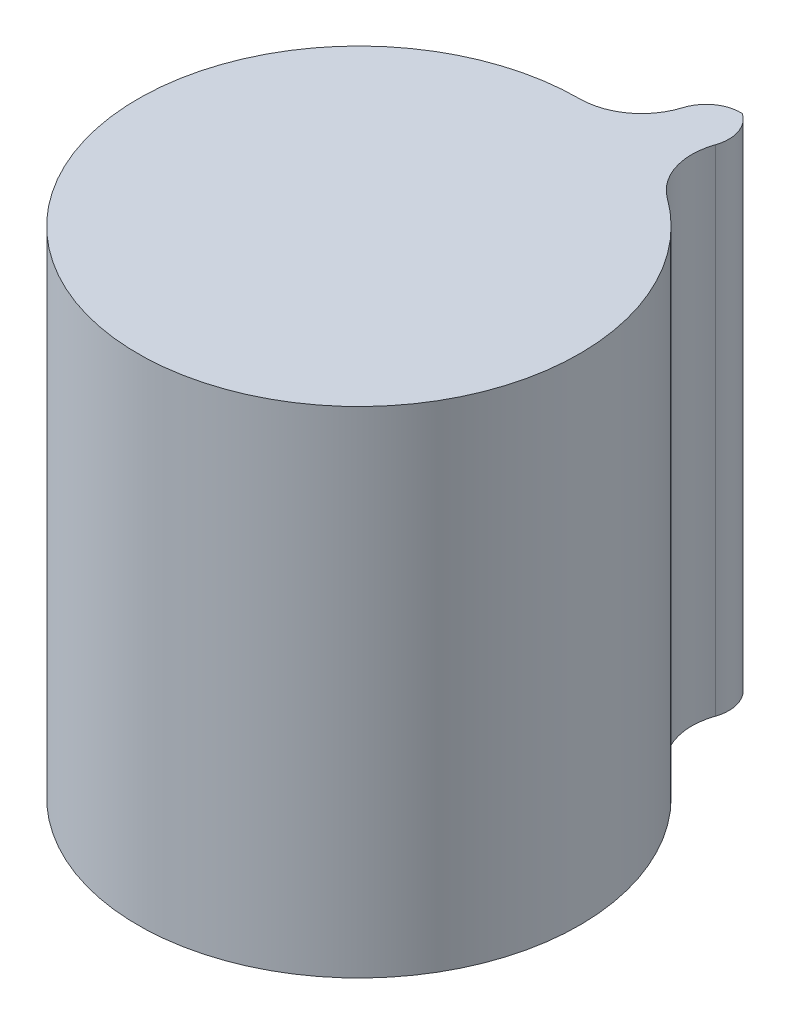
from build123d import *

# Parameters (mm, degrees)
BOSS_EXTRUDE1_DEPTH = 3.556


with BuildPart() as part:
    # Sketch1 → Boss-Extrude1 (new, symmetric)
    with BuildSketch(Plane(origin=(0, 0, 0), x_dir=(1, 0, 0), z_dir=(0, 1, 0))):
        with BuildLine():
            ThreePointArc((0.851535457, 3.803970871), (0.529976857, 3.34779037), (0, 3.172790042))
            ThreePointArc((0, 3.172790042), (-0.980446042, -3.017502644), (1.864919195, 2.566841063))
            ThreePointArc((1.864919195, 2.566841063), (1.539021523, 3.019931883), (1.547011322, 3.577997065))
            ThreePointArc((1.547011322, 3.577997065), (1.548224169, 3.901563725), (1.351055159, 4.158120222))
            ThreePointArc((1.351055159, 4.158120222), (1.040741955, 4.066454692), (0.851535457, 3.803970871))
        make_face()
    extrude(amount=BOSS_EXTRUDE1_DEPTH, both=True)


solid = part.part
